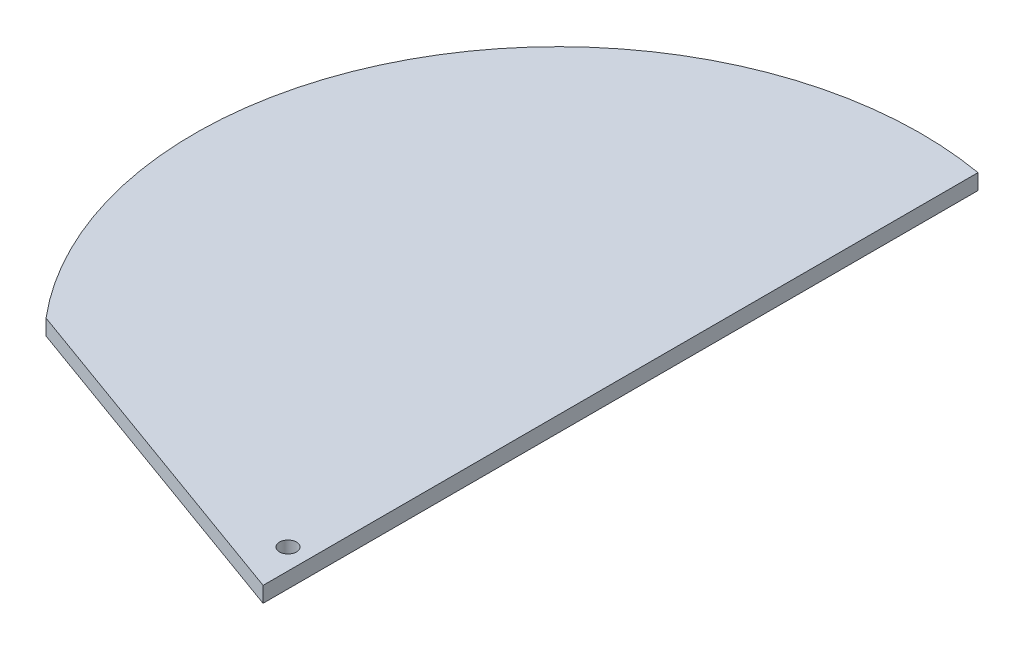
from build123d import *

# Parameters (mm, degrees)
SKETCH1_R           = 1.65
BOSS_EXTRUDE1_DEPTH = 3


with BuildPart() as part:
    # Sketch1 → Boss-Extrude1 (new body)
    with BuildSketch(Plane(origin=(0, 0, 0), x_dir=(1, 0, 0), z_dir=(0, 1, 0))):
        with BuildLine():
            Line((12, 68.963758598), (12, -68.802405773))
            Line((12, -68.802405773), (-53.528576558, -45.107554707))
            ThreePointArc((-53.528576558, -45.107554707), (-60.697790714, 34.868011163), (12, 68.963758598))
        make_face()
        with Locations((8, -60)):
            Circle(SKETCH1_R, mode=Mode.SUBTRACT)
    extrude(amount=BOSS_EXTRUDE1_DEPTH)


solid = part.part
